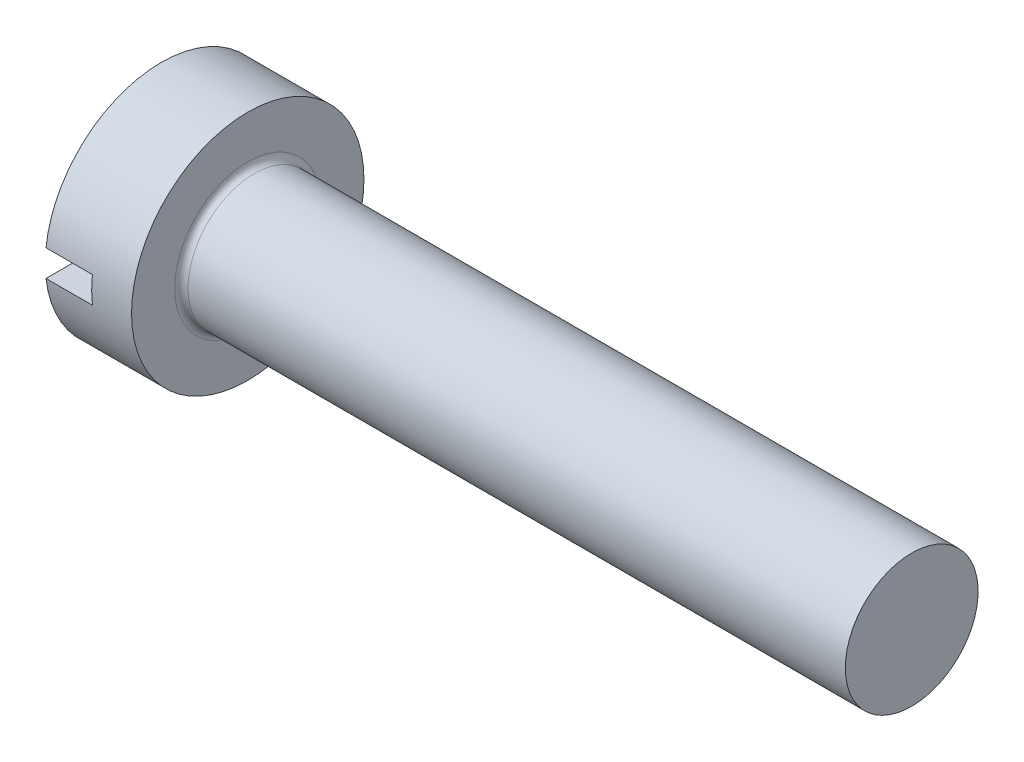
from build123d import *

# Parameters (mm, degrees)
FILLET1_R  = 0.4
SLOTSKE_W  = 14
SLOTSKE_H  = 1.6
SLOT_DEPTH = 2.8


with BuildPart() as part:
    # BodySke → BaseBody (revolve)
    with BuildSketch(Plane.XY):
        Polygon((5.2, 7), (5.2, 4), (45.2, 4), (45.2, 0), (0, 0), (0, 7), align=None)
    revolve(axis=Axis((0, 0, 0), (1, 0, 0)))

    # Fillet1
    fillet1_edges = [part.edges().sort_by_distance(p)[0] for p in [
        (5.2, -4, 0),
    ]]
    fillet(fillet1_edges, radius=FILLET1_R)

    # SlotSke → Slot (cut)
    with BuildSketch(Plane(origin=(0, 0, 0), x_dir=(0, 0, -1), z_dir=(1, 0, 0))):
        Rectangle(SLOTSKE_W, SLOTSKE_H)
    extrude(amount=SLOT_DEPTH, mode=Mode.SUBTRACT)


solid = part.part
